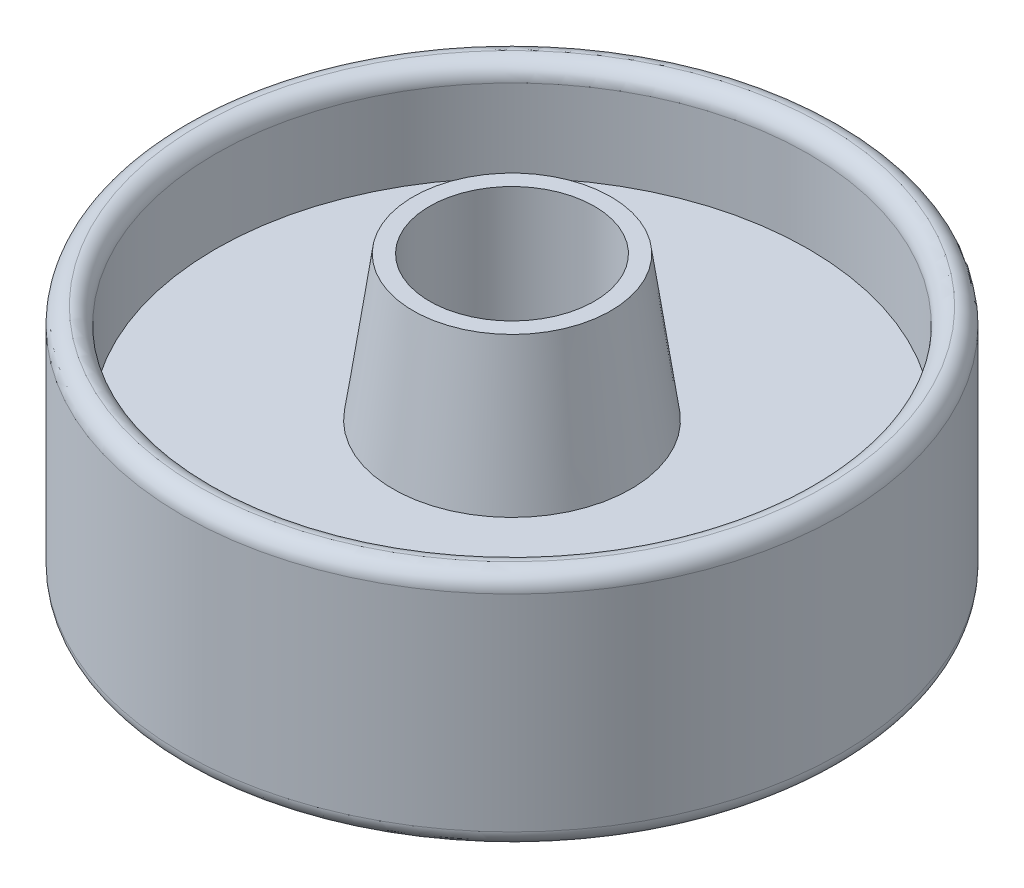
from build123d import *

# Parameters (mm, degrees)
FILLET2_R = 2


with BuildPart() as part:
    # Sketch1 → Revolve1 (revolve)
    with BuildSketch(Plane.XY, mode=Mode.PRIVATE) as revolve1_sk:
        Polygon((10, -20), (12, -20), (14.459464607, -2.5), (36, -2.5), (36, -14.5), (40, -14.5), (40, 14.5), (36, 14.5), (36, 2.5), (14.459464607, 2.5), (12, 20), (10, 20), align=None)
    revolve(revolve1_sk.sketch.rotate(Axis((0, -24.578986378, 0), (0, 1, 0)), 90), axis=Axis((0, -24.578986378, 0), (0, 1, 0)))

    # Fillet2
    fillet2_edges = [part.edges().sort_by_distance(p)[0] for p in [
        (0, 14.5, 36),
        (0, 14.5, 40),
        (0, -14.5, 40),
        (0, -14.5, 36),
    ]]
    fillet(fillet2_edges, radius=FILLET2_R - 0.0001)  # a hair under: the kernel refuses the full size


solid = part.part
